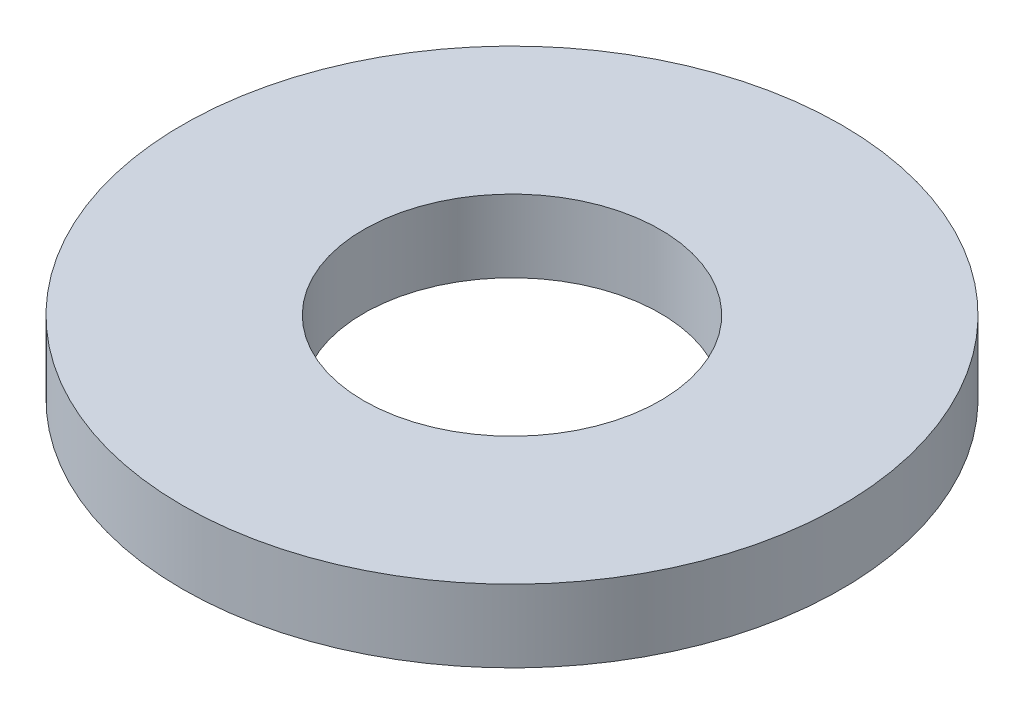
from build123d import *

# Parameters (mm, degrees)
SKETCH1_R           = 100
BOSS_EXTRUDE1_DEPTH = 22
SKETCH2_R           = 45
CUT_EXTRUDE1_DEPTH  = 144.122325303


with BuildPart() as part:
    # Sketch1 → Boss-Extrude1 (new body)
    with BuildSketch(Plane(origin=(0, 0, 0), x_dir=(1, 0, 0), z_dir=(0, 1, 0))):
        Circle(SKETCH1_R)
    extrude(amount=BOSS_EXTRUDE1_DEPTH)

    # Sketch2 → Cut-Extrude1 (cut, through all)
    with BuildSketch(Plane(origin=(0, 0, 0), x_dir=(1, 0, 0), z_dir=(0, 1, 0))):
        Circle(SKETCH2_R)
    extrude(amount=CUT_EXTRUDE1_DEPTH, mode=Mode.SUBTRACT)


solid = part.part
